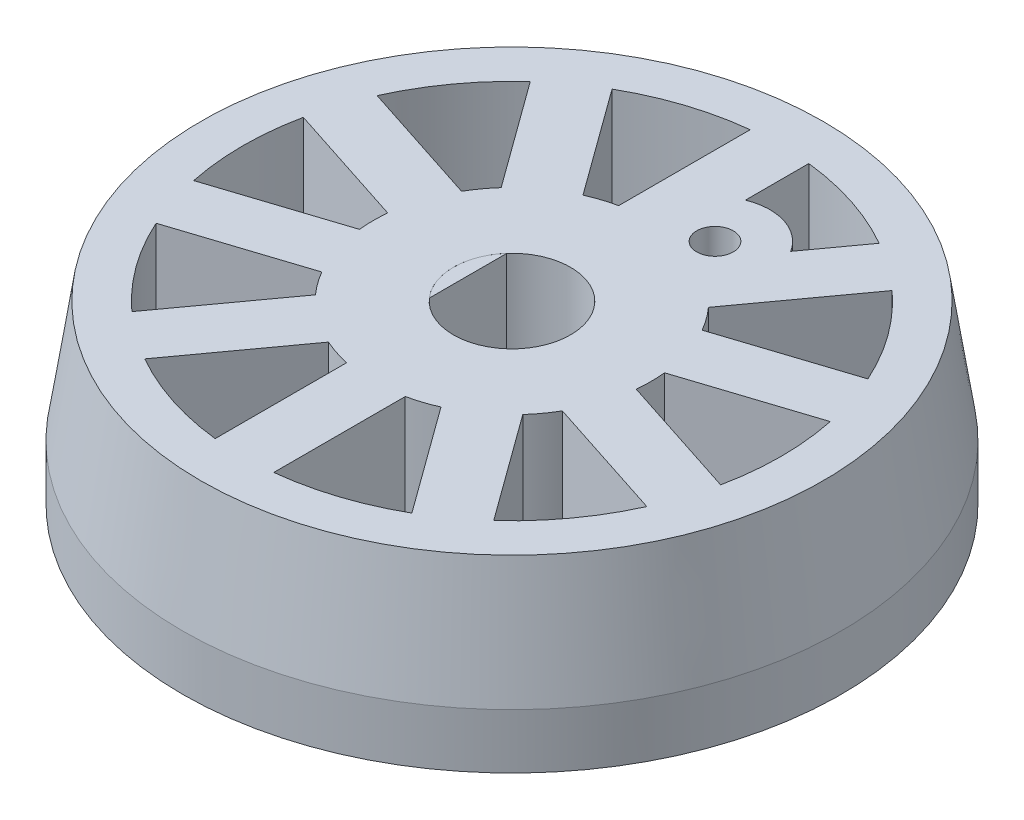
from build123d import *

# Parameters (mm, degrees)
SKETCH_4_R               = 11.6
SKETCH_4_R_2             = 1.6
EXTRUDE_1_DEPTH          = 1.1
EXTRUDE_START            = 1.5
SKETCH_4_3_R             = 9
SKETCH_4_3_R_2           = 1.6
EXTRUDE_2_DEPTH          = 3.3
CHAMFER_1_SIZE           = 0.2
SKETCH_4_4_R             = 1.6
CUT_EXTRUDE_2_DEPTH      = 18.092688495
CHAMFER_2_SIZE           = 0.5
CHAMFER_2_SIZE_2         = 3.3
CUT_EXTRUDE_4_DEPTH      = 18.092688495
EXTRUDE_3_DEPTH          = 4.8
PATTERN_CIRCULAR_2_COUNT = 10
SKETCH_6_R               = 1.5
EXTRUDE_4_DEPTH          = 4.8
SKETCH_6_3_R             = 0.5
CUT_EXTRUDE_5_DEPTH      = 18.092688495
EXTRUDE_5_DEPTH          = 4.8
SKETCH_7_OUTSIDE_W       = 31.832
SKETCH_7_OUTSIDE_H       = 31.832
SKETCH_7_OUTSIDE_R       = 9
CUT_EXTRUDE_6_DEPTH      = 18.092688495


with BuildPart() as part:
    # 草图4 → 凸台-拉伸1 (new body)
    with BuildSketch(Plane(origin=(0, 0, 0), x_dir=(1, 0, 0), z_dir=(0, 1, 0))):
        with Locations(Location((0, 0, 0), (0, 0, 270))):
            Circle(SKETCH_4_R)
        with Locations(Location((0, 0, 0), (0, 0, 270))):
            Circle(SKETCH_4_R_2, mode=Mode.SUBTRACT)
    extrude(amount=EXTRUDE_1_DEPTH)

    # 倒角1
    chamfer_1_edges = [part.edges().sort_by_distance(p)[0] for p in [
        (0, 1.1, -11.6),
    ]]
    chamfer(chamfer_1_edges, length=CHAMFER_1_SIZE)


with BuildPart() as body_2:
    # 草图4<3> → 凸台-拉伸2 (new body)
    with BuildSketch(Plane(origin=(0, 0, 0), x_dir=(1, 0, 0), z_dir=(0, 1, 0)).offset(EXTRUDE_START)):
        with Locations(Location((0, 0, 0), (0, 0, 270))):
            Circle(SKETCH_4_3_R)
        with Locations(Location((0, 0, 0), (0, 0, 270))):
            Circle(SKETCH_4_3_R_2, mode=Mode.SUBTRACT)
    extrude(amount=EXTRUDE_2_DEPTH)


    add(part.part)  # loft_1 joins it to this body
    # loft up to a face of the part (loft_1)
    loft([Face(Wire([body_2.edges().sort_by_distance((-6.560717647, 1.5, -6.160923953))[0]])), Face(Wire([body_2.edges().sort_by_distance((8.310242353, 1.1, -7.803837008))[0]]))])

    # 草图4<4> → 切除-拉伸2 (cut, through all)
    with BuildSketch(Plane(origin=(0, 0, 0), x_dir=(1, 0, 0), z_dir=(0, 1, 0))):
        with Locations(Location((0, 0, 0), (0, 0, 270))):
            Circle(SKETCH_4_4_R)
    extrude(amount=CUT_EXTRUDE_2_DEPTH, mode=Mode.SUBTRACT)

    # 倒角2
    # the kernel refuses this chamfer: 3.3, 0.5 mm, written as the material it takes off along each edge
    with BuildSketch(Plane(origin=(0, 4.8, 0), x_dir=(0, 0, 1), z_dir=(-1, 0, 0))) as chamfer_2_piece_1:
        Polygon((9 - CHAMFER_2_SIZE, 0), (9, -CHAMFER_2_SIZE_2), (9, 0), align=None)
    revolve(axis=Axis((0, 4.8, 0), (0, 1, 0)), mode=Mode.SUBTRACT)

    # 草图5 → 切除-拉伸4 (cut, through all)
    with BuildSketch(Plane(origin=(0, 4.8, 0), x_dir=(1, 0, 0), z_dir=(0, 1, 0))):
        with BuildLine():
            ThreePointArc((3.8, 0), (-2.387467277, -2.9563491), (-0.8, 3.714835124))
            Line((-0.8, 3.714835124), (-0.8, 7.30633287))
            ThreePointArc((-0.8, 7.30633287), (-4.906246019, -5.47277352), (7.35, 0))
            ThreePointArc((7.35, 0), (5.47277352, 4.906246019), (0.8, 7.30633287))
            Line((0.8, 7.30633287), (0.8, 3.714835124))
            ThreePointArc((0.8, 3.714835124), (2.9563491, 2.387467277), (3.8, 0))
        make_face()
        with BuildLine():
            Line((-0.8, 7.30633287), (-0.8, 3.714835124))
            ThreePointArc((-0.8, 3.714835124), (-0.402260194, 3.778648798), (0, 3.8))
            Line((0, 3.8), (0, 7.35))
            ThreePointArc((0, 7.35), (-0.400595438, 7.339075098), (-0.8, 7.30633287))
        make_face()
        with BuildLine():
            Line((0, 7.35), (0, 3.8))
            ThreePointArc((0, 3.8), (0.402260194, 3.778648798), (0.8, 3.714835124))
            Line((0.8, 3.714835124), (0.8, 7.30633287))
            ThreePointArc((0.8, 7.30633287), (0.400595438, 7.339075098), (0, 7.35))
        make_face()
    extrude(amount=-CUT_EXTRUDE_4_DEPTH, mode=Mode.SUBTRACT)


with BuildPart() as cut_extrude_4_piece_1:
    # of the separate pieces the step leaves, piece 1, a body of its own (cut_extrude_4_pieces)
    add(body_2.part.solids().sort_by_distance((0, 0.9, 11.6))[0])

    # 草图5<4> → 凸台-拉伸3 (add)
    with BuildSketch(Plane(origin=(0, 4.8, 0), x_dir=(1, 0, 0), z_dir=(0, 1, 0))):
        with BuildLine():
            Line((0, 7.35), (0, 3.8))
            ThreePointArc((0, 3.8), (0.402260194, 3.778648798), (0.8, 3.714835124))
            Line((0.8, 3.714835124), (0.8, 7.30633287))
            ThreePointArc((0.8, 7.30633287), (0.400595438, 7.339075098), (0, 7.35))
        make_face()
        with BuildLine():
            Line((-0.8, 7.30633287), (-0.8, 3.714835124))
            ThreePointArc((-0.8, 3.714835124), (-0.402260194, 3.778648798), (0, 3.8))
            Line((0, 3.8), (0, 7.35))
            ThreePointArc((0, 7.35), (-0.400595438, 7.339075098), (-0.8, 7.30633287))
        make_face()
    extrude_3 = extrude(amount=-EXTRUDE_3_DEPTH)

    # 阵列(圆周)2: 凸台-拉伸3 ×10 about axis
    pattern_circular_2_axis = Axis((0, 0, 0), (0, 1, 0))
    for i in range(1, PATTERN_CIRCULAR_2_COUNT):
        add(extrude_3.rotate(pattern_circular_2_axis, i * 360 / PATTERN_CIRCULAR_2_COUNT))



with BuildPart() as cut_extrude_4_piece_2:
    # of the separate pieces the step leaves, piece 2, a body of its own (cut_extrude_4_pieces)
    add(body_2.part.solids().sort_by_distance((-0.8, 0, -3.714835124))[0])


with BuildPart() as cut_extrude_4_piece_1_1:
    add(cut_extrude_4_piece_1.part)

    add(cut_extrude_4_piece_2.part)  # 凸台-拉伸4 merges 切除-拉伸4 piece 2
    # 草图6 → 凸台-拉伸4 (add, through all)
    with BuildSketch(Plane(origin=(0, 4.8, 0), x_dir=(1, 0, 0), z_dir=(0, 1, 0))):
        with Locations((1.359674775, 4.184648672)):
            Circle(SKETCH_6_R)
    extrude(amount=-EXTRUDE_4_DEPTH)

    # 草图6<3> → 切除-拉伸5 (cut, through all)
    with BuildSketch(Plane(origin=(0, 4.8, 0), x_dir=(1, 0, 0), z_dir=(0, 1, 0))):
        with Locations(Location((1.359674775, 4.184648672, 0), (0, 0, 270))):
            Circle(SKETCH_6_3_R)
    extrude(amount=-CUT_EXTRUDE_5_DEPTH, mode=Mode.SUBTRACT)

    # 草图7 outside → 切除-拉伸6 (cut, through all)
    with BuildSketch(Plane(origin=(0, 4.8, 0), x_dir=(1, 0, 0), z_dir=(0, 1, 0))):
        Rectangle(SKETCH_7_OUTSIDE_W, SKETCH_7_OUTSIDE_H)
        with Locations(Location((0, 0, 0), (0, 0, 270))):
            Circle(SKETCH_7_OUTSIDE_R, mode=Mode.SUBTRACT)
    extrude(amount=-CUT_EXTRUDE_6_DEPTH, mode=Mode.SUBTRACT)


with BuildPart() as body_2_2:
    # 草图4<6> → 凸台-拉伸5 (new body)
    with BuildSketch(Plane(origin=(0, 0, 0), x_dir=(1, 0, 0), z_dir=(0, 1, 0))):
        with BuildLine():
            Line((-1.2, -1.058300524), (-1.2, 1.058300524))
            ThreePointArc((-1.2, 1.058300524), (-1.6, 0), (-1.2, -1.058300524))
        make_face()
    extrude(amount=EXTRUDE_5_DEPTH)


solid = Compound([cut_extrude_4_piece_1_1.part, body_2_2.part])
